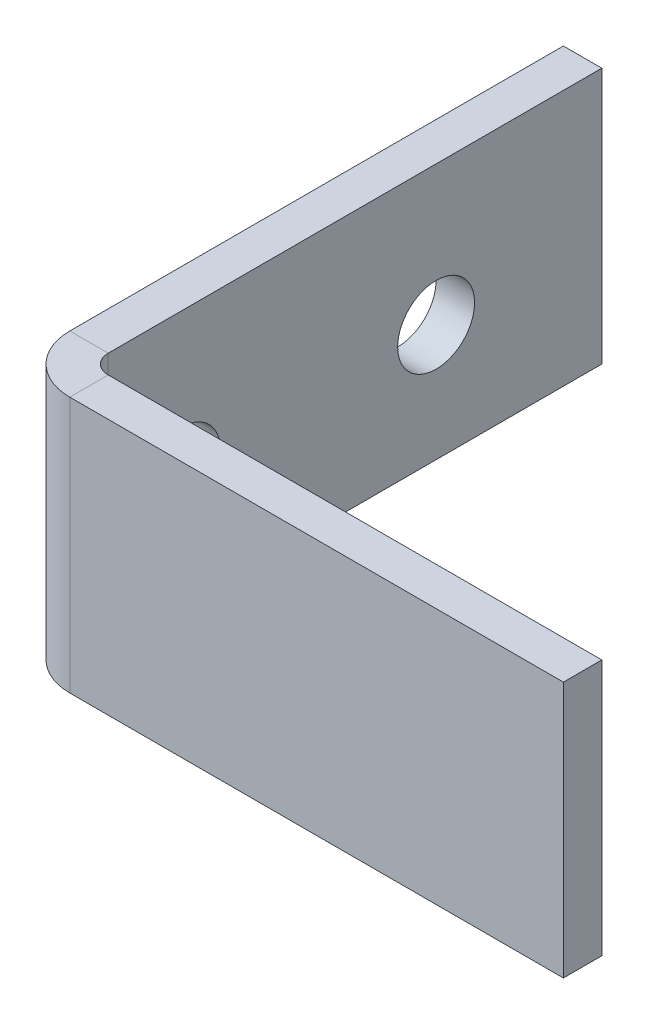
from build123d import *

# Parameters (mm, degrees)
BASE_FLANGE1_DEPTH                 = 10
F_3_0MM_TRANSITIONAL_DOWEL_HOLE1_D = 3


# Sheet-metal steps are written as plain solids
with BuildPart() as part:
    # Sketch1 → Base-Flange1 (new body)
    with BuildSketch(Plane(origin=(0, 0, 0), x_dir=(1, 0, 0), z_dir=(0, 1, 0))):
        with BuildLine():
            Line((0, 0), (0, -19.2634))
            ThreePointArc((0, -19.2634), (0.215745145, -19.784254855), (0.7366, -20))
            Line((0.7366, -20), (20, -20))
            Line((20, -20), (20, -21.5))
            Line((20, -21.5), (0.7366, -21.5))
            ThreePointArc((0.7366, -21.5), (-0.844915027, -20.844915027), (-1.5, -19.2634))
            Line((-1.5, -19.2634), (-1.5, 0))
            Line((-1.5, 0), (0, 0))
        make_face()
    extrude(amount=BASE_FLANGE1_DEPTH)

    # Ø3.0mm Transitional Dowel Hole1 (through all)
    with Locations(Plane.ZY.offset(1.5)):
        with Locations((16.387023366, 4.560762846), (6.466703516, 4.560762846)):
            Hole(F_3_0MM_TRANSITIONAL_DOWEL_HOLE1_D / 2)


solid = part.part
